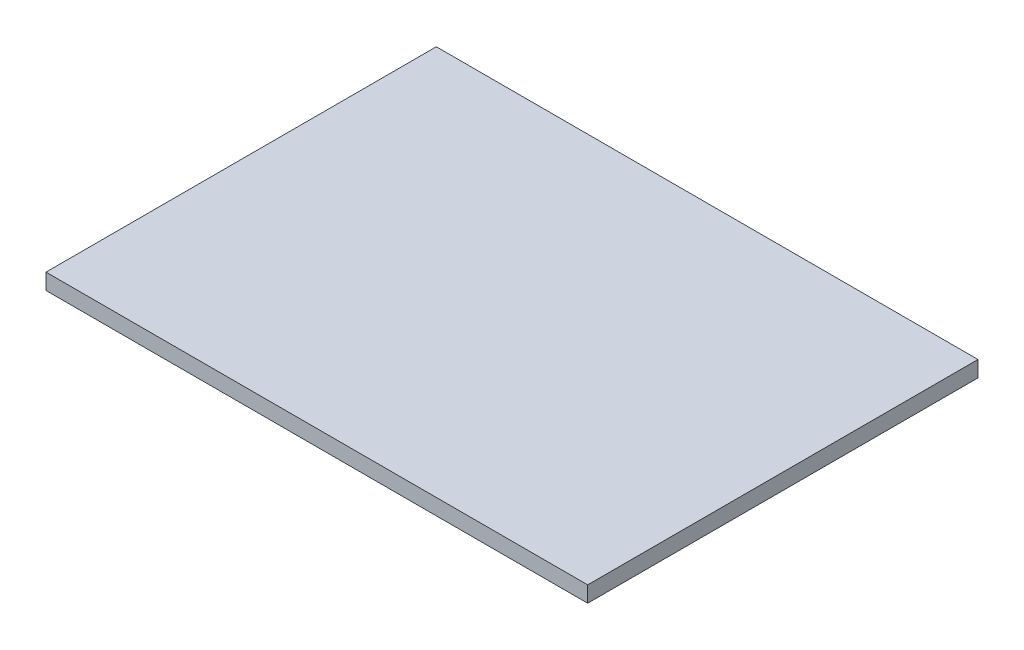
from build123d import *

# Parameters (mm, degrees)
SKETCH1_W           = 340
SKETCH1_H           = 245
BOSS_EXTRUDE1_DEPTH = 10


with BuildPart() as part:
    # Sketch1 → Boss-Extrude1 (new body)
    with BuildSketch(Plane(origin=(0, 0, 0), x_dir=(1, 0, 0), z_dir=(0, 1, 0))):
        Rectangle(SKETCH1_W, SKETCH1_H)
    extrude(amount=BOSS_EXTRUDE1_DEPTH)


solid = part.part
